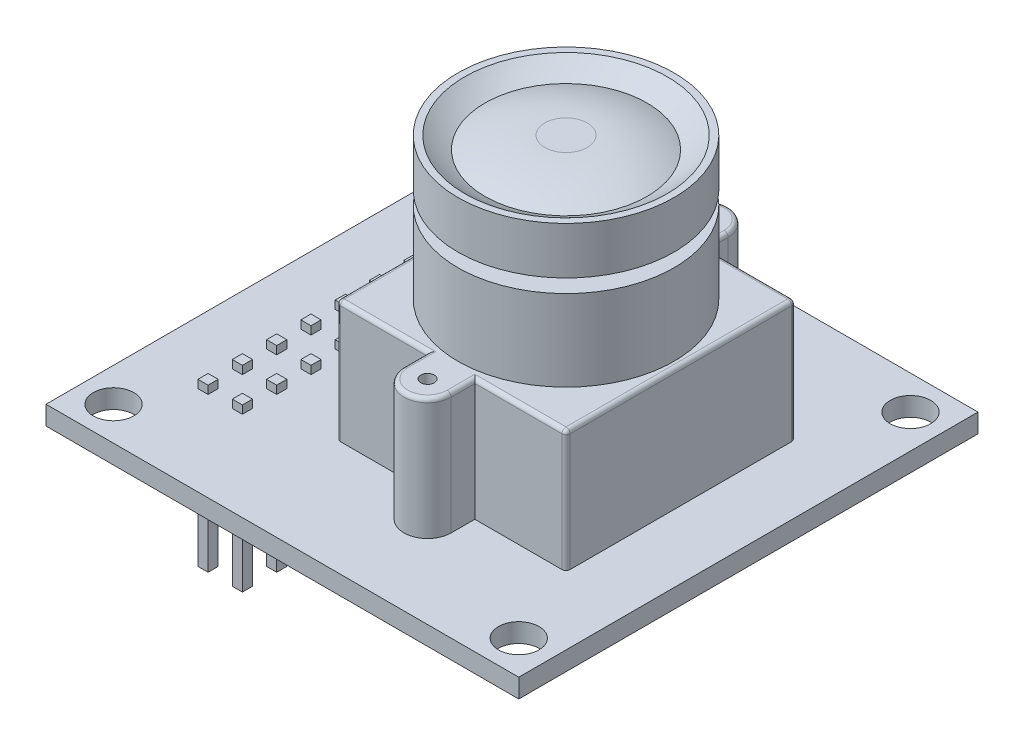
from build123d import *

# Parameters (mm, degrees)
SKETCH1_W                = 35
SKETCH1_H                = 34
SKETCH1_R                = 1.5
BOSS_EXTRUDE1_DEPTH      = 1.4
SKETCH2_R                = 0.5
BOSS_EXTRUDE2_DEPTH      = 9
BOSS_EXTRUDE3_DEPTH      = 6
SKETCH4_R                = 6
BOSS_EXTRUDE4_DEPTH      = 1
SKETCH5_R                = 8
BOSS_EXTRUDE5_DEPTH      = 3.5
SKETCH6_R                = 7.5
CUT_EXTRUDE1_DEPTH       = 2
FILLET1_R                = 10
SKETCH7_R                = 6
BOSS_EXTRUDE6_DEPTH      = 2
FILLET2_R                = 11
FILLET3_R                = 0.3
SKETCH8_R                = 0.5
CUT_EXTRUDE2_DEPTH       = 0.5
BOSS_EXTRUDE7_DEPTH      = 10
BOSS_EXTRUDE7_DEPTH_BACK = 2
SKETCH9_W                = 0.75
SKETCH9_H                = 0.75
SKETCH10_W               = 5.29
SKETCH10_H               = 23.07
BOSS_EXTRUDE8_DEPTH      = 3
FILLET4_R                = 1


with BuildPart() as part:
    # Sketch1 → Boss-Extrude1 (new body)
    with BuildSketch(Plane(origin=(0, 0, 0), x_dir=(1, 0, 0), z_dir=(0, 1, 0))):
        with Locations((-1.733490566, -8.5)):
            Rectangle(SKETCH1_W, SKETCH1_H)
        with Locations(Location((-16.733490566, 6, 0), (0, 0, 270))):
            Circle(SKETCH1_R, mode=Mode.SUBTRACT)
        with Locations(Location((-16.733490566, -23, 0), (0, 0, 270))):
            Circle(SKETCH1_R, mode=Mode.SUBTRACT)
        with Locations(Location((13.266509434, 6, 0), (0, 0, 270))):
            Circle(SKETCH1_R, mode=Mode.SUBTRACT)
        with Locations(Location((13.266509434, -23, 0), (0, 0, 270))):
            Circle(SKETCH1_R, mode=Mode.SUBTRACT)
    extrude(amount=BOSS_EXTRUDE1_DEPTH)

    # Sketch2 → Boss-Extrude2 (add)
    with BuildSketch(Plane(origin=(0, 1.4, 0), x_dir=(1, 0, 0), z_dir=(0, 1, 0))):
        with BuildLine():
            Line((-6.233490566, 0), (0.516509434, 0))
            Line((0.516509434, 0), (0.516509434, 1.75))
            ThreePointArc((0.516509434, 1.75), (2.266509434, 3.5), (4.016509434, 1.75))
            Line((4.016509434, 1.75), (4.016509434, 0))
            Line((4.016509434, 0), (10.766509434, 0))
            Line((10.766509434, 0), (10.766509434, -17))
            Line((10.766509434, -17), (4.016509434, -17))
            Line((4.016509434, -17), (4.016509434, -18.75))
            ThreePointArc((4.016509434, -18.75), (2.266509434, -20.5), (0.516509434, -18.75))
            Line((0.516509434, -18.75), (0.516509434, -17))
            Line((0.516509434, -17), (-6.233490566, -17))
            Line((-6.233490566, -17), (-6.233490566, 0))
        make_face()
        with Locations(Location((2.266509434, 1.75, 0), (0, 0, 270))):
            Circle(SKETCH2_R, mode=Mode.SUBTRACT)
        with Locations(Location((2.266509434, -18.75, 0), (0, 0, 270))):
            Circle(SKETCH2_R, mode=Mode.SUBTRACT)
    extrude(amount=BOSS_EXTRUDE2_DEPTH)

    # Sketch3 → Boss-Extrude3 (add)
    with BuildSketch(Plane(origin=(0, 10.4, 0), x_dir=(1, 0, 0), z_dir=(0, 1, 0))):
        with BuildLine():
            Line((-6.233490566, -9.5), (-5.670744499, -9.5))
            ThreePointArc((-5.670744499, -9.5), (10.266509434, -8.5), (-5.670744499, -7.5))
            Line((-5.670744499, -7.5), (-6.233490566, -7.5))
            Line((-6.233490566, -7.5), (-6.233490566, -9.5))
        make_face()
    extrude(amount=BOSS_EXTRUDE3_DEPTH)

    # Sketch4 → Boss-Extrude4 (add)
    with BuildSketch(Plane(origin=(0, 16.4, 0), x_dir=(1, 0, 0), z_dir=(0, 1, 0))):
        with Locations(Location((2.266509434, -8.5, 0), (0, 0, 270))):
            Circle(SKETCH4_R)
    extrude(amount=BOSS_EXTRUDE4_DEPTH)

    # Sketch5 → Boss-Extrude5 (add)
    with BuildSketch(Plane(origin=(0, 17.4, 0), x_dir=(1, 0, 0), z_dir=(0, 1, 0))):
        with Locations(Location((2.266509434, -8.5, 0), (0, 0, 270))):
            Circle(SKETCH5_R)
    extrude(amount=BOSS_EXTRUDE5_DEPTH)

    # Sketch6 → Cut-Extrude1 (cut)
    with BuildSketch(Plane(origin=(0, 20.9, 0), x_dir=(1, 0, 0), z_dir=(0, 1, 0))):
        with Locations(Location((2.266509434, -8.5, 0), (0, 0, 270))):
            Circle(SKETCH6_R)
    extrude(amount=-CUT_EXTRUDE1_DEPTH, mode=Mode.SUBTRACT)

    # Fillet1
    # the kernel refuses this fillet: 10 mm, written as the material it adds along each edge
    with BuildSketch(Plane(origin=(2.266509434, 18.9, 8.5), x_dir=(0, 0, 1), z_dir=(-1, 0, 0))) as fillet1_piece_1:
        with BuildLine():
            CenterArc((1.5, 10), FILLET1_R, 270, 36.869897646)
            Line((1.5, 0), (1.5, -0.2))
            Line((1.5, -0.2), (7.5, -0.2))
            Line((7.5, -0.2), (7.7, 0))
            ThreePointArc((7.7, 0), (7.7, 1), (7.62, 1.84))
            Line((7.62, 1.84), (7.5, 2))
        make_face()
    revolve(axis=Axis((2.266509434, 18.9, 8.5), (0, 1, 0)))

    # Sketch7 → Boss-Extrude6 (add)
    with BuildSketch(Plane(origin=(0, 18.9, 0), x_dir=(1, 0, 0), z_dir=(0, 1, 0))):
        with Locations(Location((2.266509434, -8.5, 0), (0, 0, 270))):
            Circle(SKETCH7_R)
    extrude(amount=BOSS_EXTRUDE6_DEPTH)

    # Fillet2
    # the kernel refuses this fillet: 11 mm, written as the material it takes off along each edge
    with BuildSketch(Plane(origin=(2.266509434, 20.9, 8.5), x_dir=(0, 0, 1), z_dir=(-1, 0, 0))) as fillet2_piece_1:
        with BuildLine():
            CenterArc((1.572715177, -11), FILLET2_R, 66.266665489, 23.733334511)
            Line((1.572715177, 0), (1.572715177, 0.22))
            Line((1.572715177, 0.22), (6, 0.22))
            Line((6, 0.22), (6.22, 0))
            ThreePointArc((6.22, 0), (6.22, -0.465142775), (6.088545695, -0.728891261))
            Line((6.088545695, -0.728891261), (5.999999999, -0.93028555))
        make_face()
    revolve(axis=Axis((2.266509434, 20.9, 8.5), (0, 1, 0)), mode=Mode.SUBTRACT)

    # Fillet3
    fillet3_edges = [part.edges().sort_by_distance(p)[0] for p in [
        (-6.233490566, 10.4, 3.75),
        (-2.858490566, 10.4, 17),
        (0.516509434, 10.4, 17.875),
        (2.266509434, 10.4, 20.5),
        (4.016509434, 10.4, 17.875),
        (7.391509434, 10.4, 17),
        (10.766509434, 10.4, 8.5),
        (7.391509434, 10.4, 0),
        (4.016509434, 10.4, -0.875),
        (2.266509434, 10.4, -3.5),
        (0.516509434, 10.4, -0.875),
        (-2.858490566, 10.4, 0),
        (-6.233490566, 5.9, 0),
        (-6.233490566, 5.9, 17),
        (10.766509434, 5.9, 17),
        (10.766509434, 5.9, 0),
        (-6.233490566, 10.4, 13.25),
    ]]
    fillet(fillet3_edges, radius=FILLET3_R)

    # Sketch8 → Cut-Extrude2 (cut)
    with BuildSketch(Plane.ZY.offset(6.233490566)):
        with Locations((8.5, 13.9)):
            Circle(SKETCH8_R)
    extrude(amount=-CUT_EXTRUDE2_DEPTH, mode=Mode.SUBTRACT)

    # Sketch9 → Boss-Extrude7 (add, two sides: drawn at the far end of the back side and taken through both)
    with BuildSketch(Plane.XZ.offset(-BOSS_EXTRUDE7_DEPTH_BACK)):
        with Locations((-14.233490566, 18.5)):
            Rectangle(SKETCH9_W, SKETCH9_H)
        with Locations((-11.693490566, 18.5)):
            Rectangle(SKETCH9_W, SKETCH9_H)
        with Locations((-14.233490566, 15.96)):
            Rectangle(SKETCH9_W, SKETCH9_H)
        with Locations((-11.693490566, 15.96)):
            Rectangle(SKETCH9_W, SKETCH9_H)
        with Locations((-14.233490566, 13.42)):
            Rectangle(SKETCH9_W, SKETCH9_H)
        with Locations((-11.693490566, 13.42)):
            Rectangle(SKETCH9_W, SKETCH9_H)
        with Locations((-14.233490566, 10.88)):
            Rectangle(SKETCH9_W, SKETCH9_H)
        with Locations((-11.693490566, 10.88)):
            Rectangle(SKETCH9_W, SKETCH9_H)
        with Locations((-14.233490566, 8.34)):
            Rectangle(SKETCH9_W, SKETCH9_H)
        with Locations((-11.693490566, 8.34)):
            Rectangle(SKETCH9_W, SKETCH9_H)
        with Locations((-14.233490566, 5.8)):
            Rectangle(SKETCH9_W, SKETCH9_H)
        with Locations((-11.693490566, 5.8)):
            Rectangle(SKETCH9_W, SKETCH9_H)
        with Locations((-14.233490566, 3.26)):
            Rectangle(SKETCH9_W, SKETCH9_H)
        with Locations((-11.693490566, 3.26)):
            Rectangle(SKETCH9_W, SKETCH9_H)
        with Locations((-14.233490566, 0.72)):
            Rectangle(SKETCH9_W, SKETCH9_H)
        with Locations((-11.693490566, 0.72)):
            Rectangle(SKETCH9_W, SKETCH9_H)
        with Locations((-14.233490566, -1.82)):
            Rectangle(SKETCH9_W, SKETCH9_H)
        with Locations((-11.693490566, -1.82)):
            Rectangle(SKETCH9_W, SKETCH9_H)
    extrude(amount=BOSS_EXTRUDE7_DEPTH + BOSS_EXTRUDE7_DEPTH_BACK)

    # Sketch10 → Boss-Extrude8 (add)
    with BuildSketch(Plane.XZ):
        with Locations((-12.963490566, 8.34)):
            Rectangle(SKETCH10_W, SKETCH10_H)
    extrude(amount=BOSS_EXTRUDE8_DEPTH)

    # Fillet4
    fillet4_edges = [part.edges().sort_by_distance(p)[0] for p in [
        (-15.608490566, -1.5, 19.875),
        (-15.608490566, -1.5, -3.195),
        (-10.318490566, -1.5, -3.195),
        (-10.318490566, -1.5, 19.875),
    ]]
    fillet(fillet4_edges, radius=FILLET4_R)


solid = part.part
